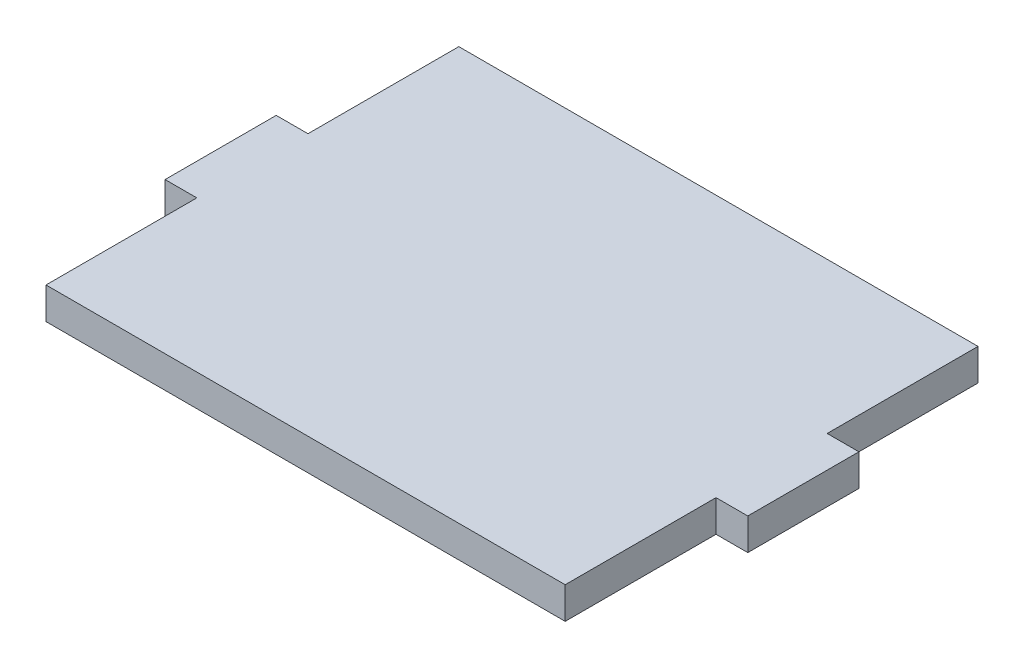
from build123d import *

# Parameters (mm, degrees)
BOSS_EXTRUDE1_DEPTH = 2


with BuildPart() as part:
    # Sketch1 → Boss-Extrude1 (new body)
    with BuildSketch(Plane(origin=(0, 0, 0), x_dir=(1, 0, 0), z_dir=(0, 1, 0))):
        Polygon((16.35, 13), (-16.35, 13), (-16.35, 3.5), (-18.35, 3.5), (-18.35, -3.5), (-16.35, -3.5), (-16.35, -13), (16.35, -13), (16.35, -3.5), (18.35, -3.5), (18.35, 3.5), (16.35, 3.5), align=None)
    extrude(amount=BOSS_EXTRUDE1_DEPTH)


solid = part.part
